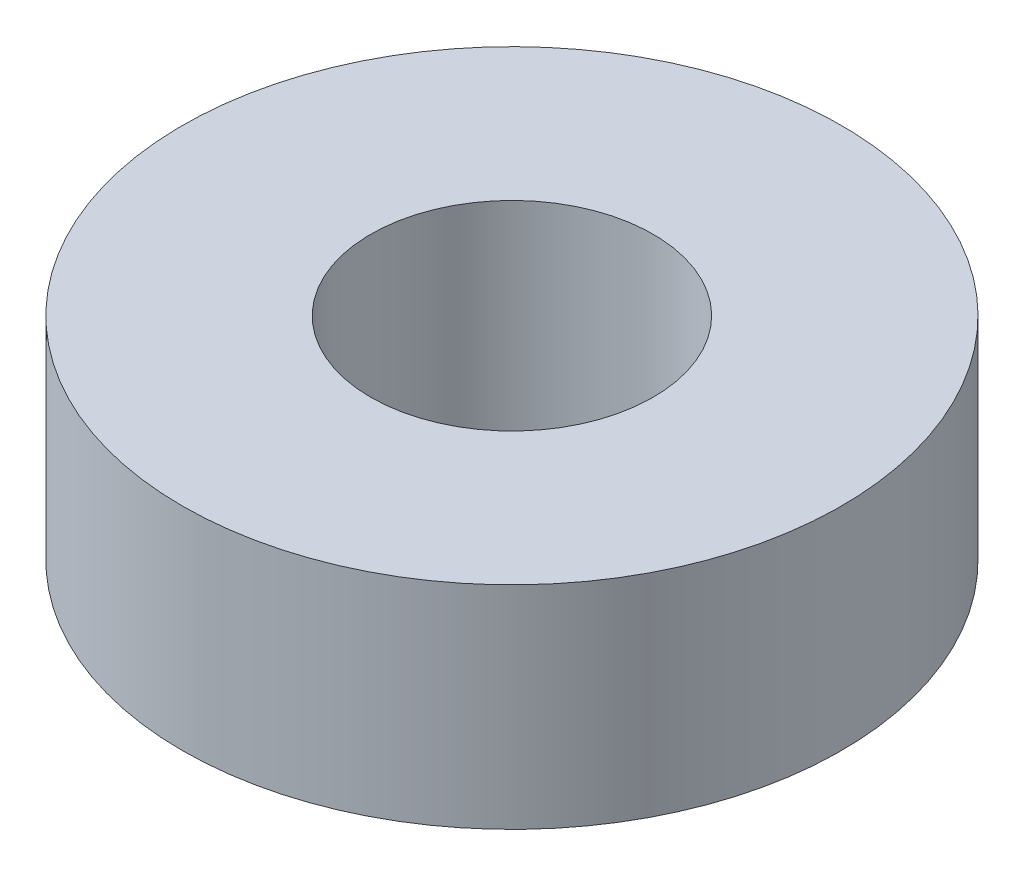
from build123d import *

# Parameters (mm, degrees)
SKETCH1_R           = 11.1125
SKETCH1_R_2         = 4.7625
BOSS_EXTRUDE1_DEPTH = 7.14248


with BuildPart() as part:
    # Sketch1 → Boss-Extrude1 (new body)
    with BuildSketch(Plane(origin=(0, 0, 0), x_dir=(1, 0, 0), z_dir=(0, 1, 0))):
        Circle(SKETCH1_R)
        Circle(SKETCH1_R_2, mode=Mode.SUBTRACT)
    extrude(amount=BOSS_EXTRUDE1_DEPTH)


solid = part.part
